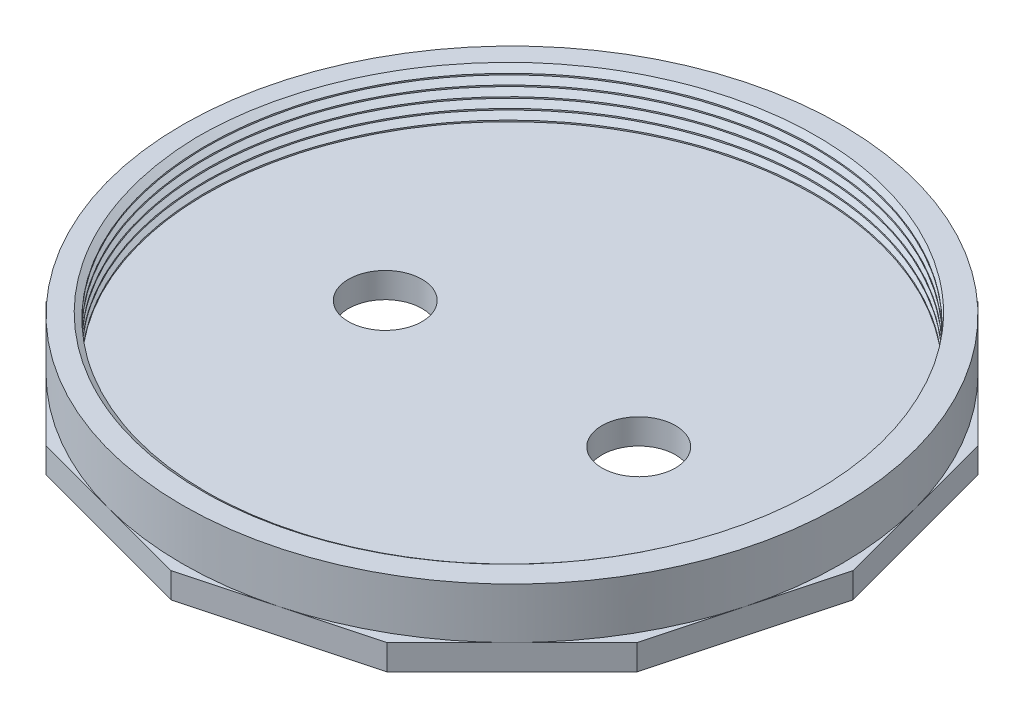
from build123d import *

# Parameters (mm, degrees)
SKETCH1_R           = 65
SKETCH1_R_2         = 60
BOSS_EXTRUDE1_DEPTH = 10
CUT_SWEEP1_PITCH    = 2
BOSS_EXTRUDE2_START = 5
SKETCH4_R           = 65
BOSS_EXTRUDE2_DEPTH = 5
SKETCH5_R           = 64
BOSS_EXTRUDE3_DEPTH = 5
SKETCH6_R           = 7.25
CUT_EXTRUDE1_DEPTH  = 10


with BuildPart() as part:
    # Sketch1 → Boss-Extrude1 (new body)
    with BuildSketch(Plane(origin=(0, 0, 0), x_dir=(1, 0, 0), z_dir=(0, 1, 0))):
        with Locations(Location((0, 0, 0), (0, 0, 270))):
            Circle(SKETCH1_R)
        with Locations(Location((0, 0, 0), (0, 0, 270))):
            Circle(SKETCH1_R_2, mode=Mode.SUBTRACT)
    extrude(amount=BOSS_EXTRUDE1_DEPTH)

    # Cut-Sweep1: arcs per turn and ends read off the stored shape
    # Cut-Sweep1: the profile of Sketch3 screwed along a right-hand helix through 7 turns, 10 arcs to a turn; built about Z, then put on its axis
    cut_sweep1_z = Axis((0, 0, 0), (0, 0, 1))
    cut_sweep1_corners = [(61.494407246, 1.0733e-05, -2.00419495), (59.244407246, 1.034e-05, -0.705156844), (59.244407246, 1.034e-05, -3.303233055)]
    with BuildLine(mode=Mode.PRIVATE) as cut_sweep1_profile:
        Line(cut_sweep1_corners[0], cut_sweep1_corners[1])
        Line(cut_sweep1_corners[1], cut_sweep1_corners[2])
        Line(cut_sweep1_corners[2], cut_sweep1_corners[0])
    cut_sweep1_cap = Face(cut_sweep1_profile.wire())
    cut_sweep1_turn_angles = [0, 18, 36, 54, 72, 90, 108, 126, 144, 162, 180, 198, 216, 234, 252, 270, 288, 306, 324, 342, 360]
    cut_sweep1_turn_weights = [1, 0.9510565162951535, 1, 0.9510565162951535, 1, 0.9510565162951535, 1, 0.9510565162951535, 1, 0.9510565162951535, 1, 0.9510565162951535, 1, 0.9510565162951535, 1, 0.9510565162951535, 1, 0.9510565162951535, 1, 0.9510565162951535, 1]
    cut_sweep1_turn_rails = [Edge.make_bspline([Vector(p[0], p[1], 0).rotate(cut_sweep1_z, cut_sweep1_turn_angles[k]) / cut_sweep1_turn_weights[k] + Vector(0, 0, p[2] + CUT_SWEEP1_PITCH * cut_sweep1_turn_angles[k] / 360) for k in range(21)], [0, 0, 0, 1, 1, 2, 2, 3, 3, 4, 4, 5, 5, 6, 6, 7, 7, 8, 8, 9, 9, 10, 10, 10], 2, cut_sweep1_turn_weights) for p in cut_sweep1_corners]
    cut_sweep1_turn_sides = [Face.make_surface_from_curves(cut_sweep1_turn_rails[p[0]], cut_sweep1_turn_rails[p[1]]) for p in [(0, 1), (1, 2), (2, 0)]]
    cut_sweep1 = Plane(origin=(0, 0, 0), x_dir=(-1, 0, 0), z_dir=(0, 1, 0)) * Solid(Shell([*[p.moved(Location((0, 0, CUT_SWEEP1_PITCH * i))) for i in range(7) for p in cut_sweep1_turn_sides], cut_sweep1_cap, cut_sweep1_cap.rotate(cut_sweep1_z, 2520).moved(Location((0, 0, CUT_SWEEP1_PITCH * 2520 / 360)))]))
    add(cut_sweep1, mode=Mode.SUBTRACT)

    # Sketch4 → Boss-Extrude2 (add)
    with BuildSketch(Plane.XZ.offset(BOSS_EXTRUDE2_START)):
        with Locations(Location((0, 0, 0), (0, 0, 270))):
            Circle(SKETCH4_R)
    extrude(amount=-BOSS_EXTRUDE2_DEPTH)

    # Sketch5 → Boss-Extrude3 (add)
    with BuildSketch(Plane.XZ.offset(5)):
        Polygon((67.292951727, 0), (58.277405691, 33.646475863), (33.646475863, 58.277405691), (0, 67.292951727), (-33.646475863, 58.277405691), (-58.277405691, 33.646475863), (-67.292951727, 0), (-58.277405691, -33.646475863), (-33.646475863, -58.277405691), (0, -67.292951727), (33.646475863, -58.277405691), (58.277405691, -33.646475863), align=None)
        Circle(SKETCH5_R, mode=Mode.SUBTRACT)
    extrude(amount=-BOSS_EXTRUDE3_DEPTH)

    # Sketch6 → Cut-Extrude1 (cut)
    with BuildSketch(Plane.XZ.offset(5)):
        with Locations(Location((-25, 0, 0), (0, 0, 270))):
            Circle(SKETCH6_R)
        with Locations(Location((25, 0, 0), (0, 0, 270))):
            Circle(SKETCH6_R)
    extrude(amount=-CUT_EXTRUDE1_DEPTH, mode=Mode.SUBTRACT)


solid = part.part
